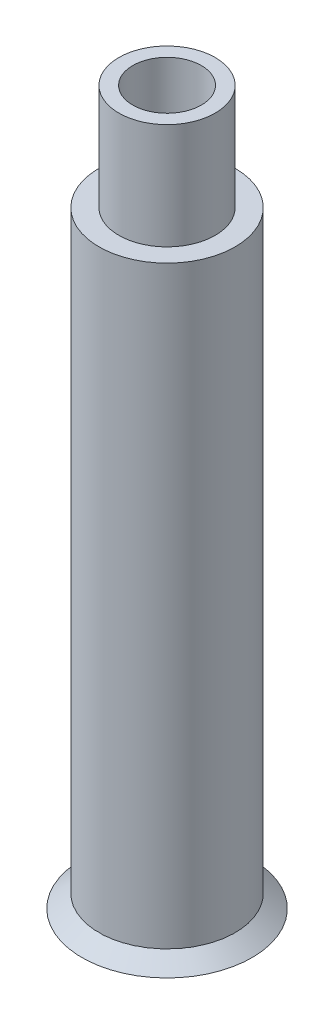
from build123d import *

# Parameters (mm, degrees)
SKETCH1_R           = 6.35
BOSS_EXTRUDE1_DEPTH = 56.642


with BuildPart() as part:
    # Sketch1 → Boss-Extrude1 (new body)
    with BuildSketch(Plane(origin=(0, 0, 0), x_dir=(1, 0, 0), z_dir=(0, 1, 0))):
        Circle(SKETCH1_R)
    extrude(amount=BOSS_EXTRUDE1_DEPTH)


with BuildPart() as body_2:
    # Sketch2 → Revolve1 (revolve)
    with BuildSketch(Plane(origin=(0, 0, 0), x_dir=(0, 0, -1), z_dir=(1, 0, 0))):
        Polygon((-4.173535709, 2.274896933), (-3.2004, 2.274896933), (-3.2004, 66.52389715), (-4.4958, 66.52389715), (-4.4958, 2.665024989), (-7.9375, 0), (-7.8359, 0), align=None)
    revolve(axis=Axis((0, 0, 0), (0, 1, 0)))


solid = Compound([part.part, body_2.part])
